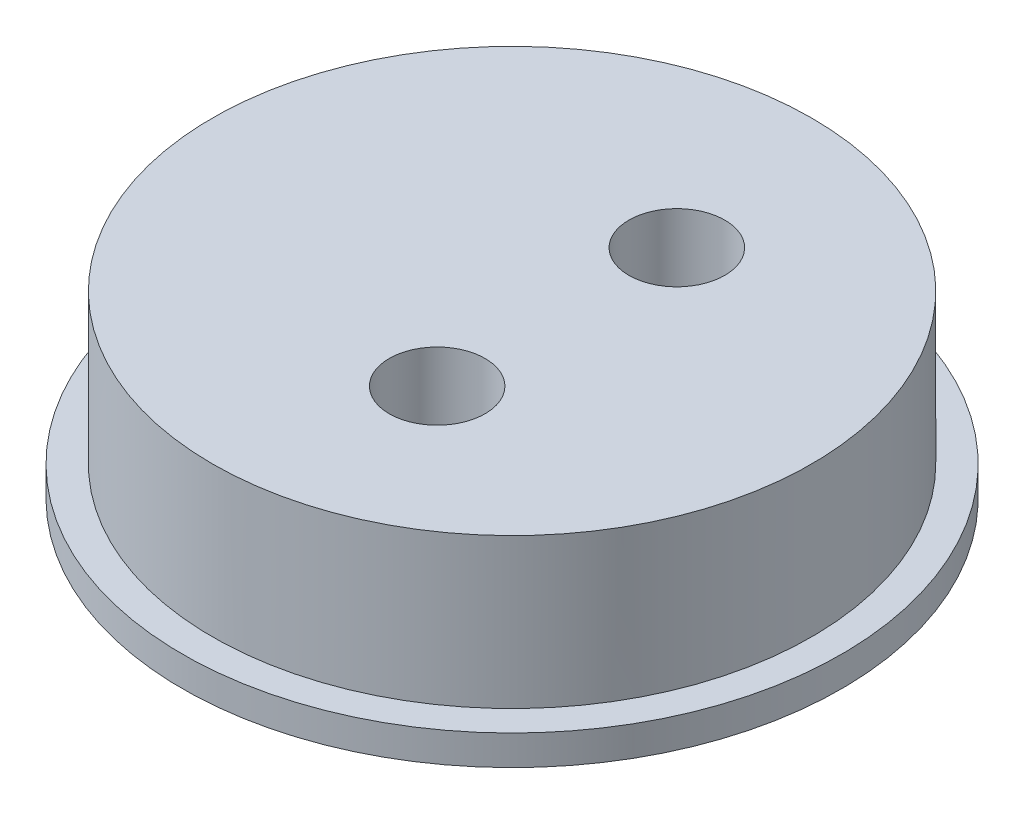
from build123d import *

# Parameters (mm, degrees)
SKETCH1_R           = 10
BOSS_EXTRUDE1_DEPTH = 6
SKETCH2_R           = 11
BOSS_EXTRUDE2_DEPTH = 1
SKETCH4_R           = 1.6
CUT_EXTRUDE1_DEPTH  = 18.69887002


with BuildPart() as part:
    # Sketch1 → Boss-Extrude1 (new body)
    with BuildSketch(Plane(origin=(0, 0, 0), x_dir=(1, 0, 0), z_dir=(0, 1, 0))):
        with Locations((-1.5, 0)):
            Circle(SKETCH1_R)
    extrude(amount=BOSS_EXTRUDE1_DEPTH)

    # Sketch2 → Boss-Extrude2 (add)
    with BuildSketch(Plane.XZ):
        with Locations((-1.5, 0)):
            Circle(SKETCH2_R)
    extrude(amount=-BOSS_EXTRUDE2_DEPTH)

    # Sketch4 → Cut-Extrude1 (cut, through all)
    with BuildSketch(Plane(origin=(0, 6, 0), x_dir=(1, 0, 0), z_dir=(0, 1, 0))):
        with Locations((0, 4)):
            Circle(SKETCH4_R)
        with Locations((0, -4)):
            Circle(SKETCH4_R)
    extrude(amount=-CUT_EXTRUDE1_DEPTH, mode=Mode.SUBTRACT)


solid = part.part
